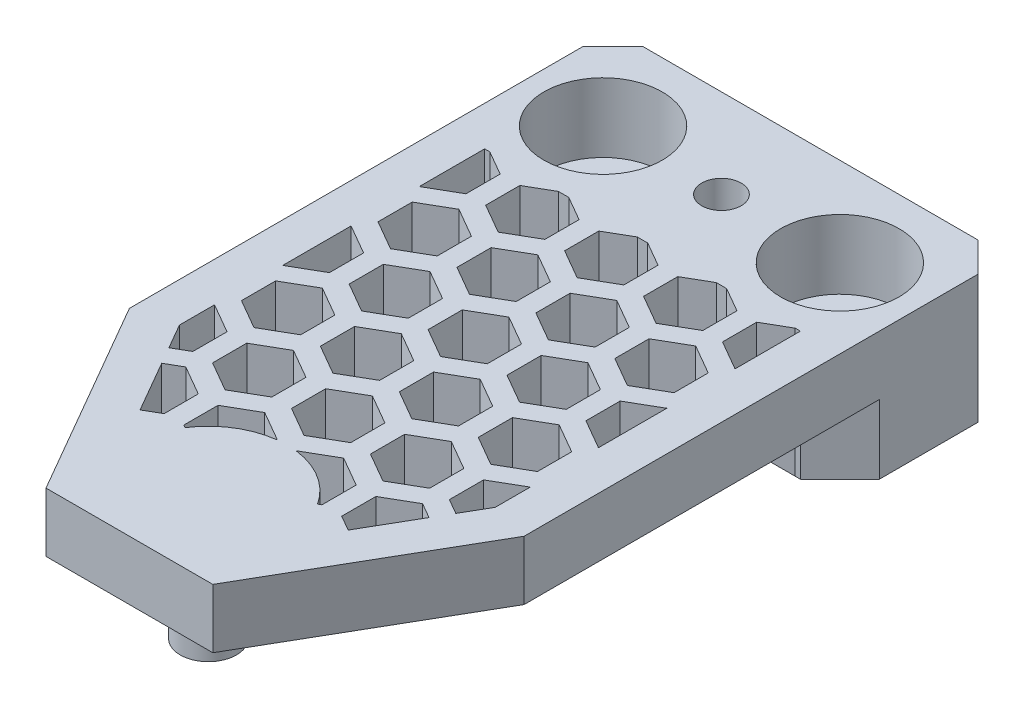
from build123d import *
from OCP.BRepFilletAPI import BRepFilletAPI_MakeChamfer
from build123d.topology import SkipClean

# Parameters (mm, degrees)
SKETCH2_W                = 20
SKETCH2_H                = 38
SKETCH2_R                = 1.5
SKETCH2_R_2              = 0.5
SKETCH2_R_3              = 1
BOSS_EXTRUDE1_DEPTH      = 3
CHAMFER2_SIZE            = 10
CHAMFER2_SIZE2           = 5.773502692
SKETCH3_R                = 1.425
BOSS_EXTRUDE2_DEPTH      = 6.5
BOSS_EXTRUDE3_START      = 3.5
SKETCH5_W                = 20
SKETCH5_H                = 12
SKETCH5_R                = 1.5
BOSS_EXTRUDE3_DEPTH      = 3.5
CHAMFER3_SIZE            = 5
CHAMFER4_SIZE            = 3.5
BOSS_EXTRUDE6_DEPTH      = 20
SKETCH13_W               = 2
SKETCH13_H               = 3.5
CUT_EXTRUDE14_DEPTH      = 3.5
CUT_EXTRUDE12_DEPTH      = 3.5
CUT_EXTRUDE12_DEPTH_BACK = 3.5
SKETCH7_R                = 3
CUT_EXTRUDE13_DEPTH      = 3.5
SKETCH9_R                = 2.625
BOSS_EXTRUDE4_DEPTH      = 0.5
BOSS_EXTRUDE5_START      = 0.55
SKETCH10_R               = 2.4
SKETCH10_R_2             = 1.5
BOSS_EXTRUDE5_DEPTH      = 0.55


with BuildPart() as part:
    # Sketch2 → Boss-Extrude1 (new body)
    with BuildSketch(Plane(origin=(0, 0, 0), x_dir=(1, 0, 0), z_dir=(0, 1, 0))):
        with Locations((0, 15)):
            Rectangle(SKETCH2_W, SKETCH2_H)
        with Locations(Location((-6, 26, 0), (0, 0, 270))):
            Circle(SKETCH2_R, mode=Mode.SUBTRACT)
        with Locations(Location((6, 26, 0), (0, 0, 270))):
            Circle(SKETCH2_R, mode=Mode.SUBTRACT)
        with Locations(Location((0, 0, 0), (0, 0, 270))):
            Circle(SKETCH2_R_2, mode=Mode.SUBTRACT)
        with Locations(Location((0, 26, 0), (0, 0, 270))):
            Circle(SKETCH2_R_3, mode=Mode.SUBTRACT)
    extrude(amount=BOSS_EXTRUDE1_DEPTH)

    # Chamfer2: one chamfer whose edges measure the first distance from different faces: ONE call of the kernel's chamfer builder (chamfer() names one face for all edges)
    chamfer2_edges_1 = [part.edges().sort_by_distance(p)[0] for p in [
        (10, 1.5, 4),
    ]]
    chamfer2_side_1 = [part.faces().sort_by_distance(p)[0] for p in [
        (10, 1.5, -15),
    ]]
    chamfer2_edges_2 = [part.edges().sort_by_distance(p)[0] for p in [
        (-10, 1.5, 4),
    ]]
    chamfer2_side_2 = [part.faces().sort_by_distance(p)[0] for p in [
        (-10, 1.5, -15),
    ]]
    chamfer2 = BRepFilletAPI_MakeChamfer(part.part.solid().wrapped)
    for e in chamfer2_edges_1:
        chamfer2.Add(CHAMFER2_SIZE, CHAMFER2_SIZE2, e.wrapped, chamfer2_side_1[0].wrapped)  # the first distance lies on this face
    for e in chamfer2_edges_2:
        chamfer2.Add(CHAMFER2_SIZE, CHAMFER2_SIZE2, e.wrapped, chamfer2_side_2[0].wrapped)  # the first distance lies on this face
    add(Compound.cast(chamfer2.Shape()), mode=Mode.REPLACE)

    # Sketch3 → Boss-Extrude2 (add)
    with BuildSketch(Plane(origin=(0, 3, 0), x_dir=(1, 0, 0), z_dir=(0, 1, 0))):
        with Locations(Location((0, 0, 0), (0, 0, 270))):
            Circle(SKETCH3_R)
    extrude(amount=-BOSS_EXTRUDE2_DEPTH)

    # Sketch5 → Boss-Extrude3 (add)
    with SkipClean():  # the faces are left unmerged after this step: merging them gives an invalid solid
        with BuildSketch(Plane.XZ.offset(BOSS_EXTRUDE3_START)):
            with Locations((0, -28)):
                Rectangle(SKETCH5_W, SKETCH5_H)
            with Locations(Location((-6, -26, 0), (0, 0, 270))):
                Circle(SKETCH5_R, mode=Mode.SUBTRACT)
            with Locations(Location((6, -26, 0), (0, 0, 270))):
                Circle(SKETCH5_R, mode=Mode.SUBTRACT)
        extrude(amount=-BOSS_EXTRUDE3_DEPTH)

    # Chamfer3
    chamfer3_edges = [part.edges().sort_by_distance(p)[0] for p in [
        (-10, -1.75, -34),
        (10, -1.75, -34),
    ]]
    chamfer(chamfer3_edges, length=CHAMFER3_SIZE)

    # Chamfer4
    # the kernel refuses this chamfer: 3.5 mm, written as the material it takes off along each edge
    with BuildSketch(Plane(origin=(-14.000890458, 3, -34), x_dir=(0, 0.027495876610586372, 0.9996219169112968), z_dir=(1, 0, 0))) as chamfer4_piece_1:
        Polygon((CHAMFER4_SIZE * 0.999621916911, CHAMFER4_SIZE * 0.0274958766106), (-CHAMFER4_SIZE * 0.0274958766106, CHAMFER4_SIZE * 0.999621916911), (0, 0), align=None)
    extrude(amount=28.001780916, mode=Mode.SUBTRACT)

    # Sketch12 → Boss-Extrude6 (add)
    with BuildSketch(Plane(origin=(10, 0, 0), x_dir=(0, 0, -1), z_dir=(1, 0, 0))):
        Polygon((22, 0), (18.5, 0), (22, -3.5), align=None)
    extrude(amount=-BOSS_EXTRUDE6_DEPTH)

    # Sketch13 → Cut-Extrude14 (cut)
    with BuildSketch(Plane.XZ.offset(3.5)):
        with Locations((-9, -20.25)):
            Rectangle(SKETCH13_W, SKETCH13_H)
        Polygon((-10, -22), (-10, -24), (-8, -22), align=None)
        with Locations((9, -20.25)):
            Rectangle(SKETCH13_W, SKETCH13_H)
        Polygon((10, -22), (8, -22), (10, -24), align=None)
    extrude(amount=-CUT_EXTRUDE14_DEPTH, mode=Mode.SUBTRACT)

    # Sketch6 → Cut-Extrude12 (cut, two sides: drawn at the far end of the back side and taken through both)
    with BuildSketch(Plane.XZ.offset(-CUT_EXTRUDE12_DEPTH_BACK)):
        Polygon((-8, -18.687949192), (-8, -22), (-7.736640276, -22), (-6.5, -21.286025404), (-6.5, -19.553974596), align=None)
        Polygon((-0.263359724, -22), (0.263359724, -22), (1.5, -21.286025404), (1.5, -19.553974596), (0, -18.687949192), (-1.5, -19.553974596), (-1.5, -21.286025404), align=None)
        Polygon((-5.5, -21.286025404), (-4.263359724, -22), (-3.736640276, -22), (-2.5, -21.286025404), (-2.5, -19.553974596), (-4, -18.687949192), (-5.5, -19.553974596), align=None)
        Polygon((6.5, -21.286025404), (7.736640276, -22), (8, -22), (8, -18.687949192), (6.5, -19.553974596), align=None)
        Polygon((2.5, -21.286025404), (3.736640276, -22), (4.263359724, -22), (5.5, -21.286025404), (5.5, -19.553974596), (4, -18.687949192), (2.5, -19.553974596), align=None)
        Polygon((-8, -11.767949192), (-8, -15.232050808), (-6.5, -14.366025404), (-6.5, -12.633974596), align=None)
        Polygon((-1.5, -14.366025404), (0, -15.232050808), (1.5, -14.366025404), (1.5, -12.633974596), (0, -11.767949192), (-1.5, -12.633974596), align=None)
        Polygon((6.5, -14.366025404), (8, -15.232050808), (8, -11.767949192), (6.5, -12.633974596), align=None)
        Polygon((-8, -6.535898385), (-8, -8.312050808), (-6.5, -7.446025404), (-6.5, -5.713974596), (-7.26909656, -5.269936491), align=None)
        Polygon((-1.5, -7.446025404), (0, -8.312050808), (1.5, -7.446025404), (1.5, -5.713974596), (0, -4.847949192), (-1.5, -5.713974596), align=None)
        Polygon((6.5, -7.446025404), (8, -8.312050808), (8, -6.535898385), (7.26909656, -5.269936491), (6.5, -5.713974596), align=None)
        Polygon((-5.272648662, -1.811987298), (-6.772648662, -4.410063509), (-6, -4.856152423), (-4.5, -3.990127019), (-4.5, -2.258076211), align=None)
        with BuildLine():
            Line((-0.5, -3.990127019), (-0.5, -3.968626967))
            ThreePointArc((-0.5, -3.968626967), (-2.126633668, -3.387835481), (-3.356749066, -2.175370246))
            Line((-3.356749066, -2.175370246), (-3.5, -2.258076211))
            Line((-3.5, -2.258076211), (-3.5, -3.990127019))
            Line((-3.5, -3.990127019), (-2, -4.856152423))
            Line((-2, -4.856152423), (-0.5, -3.990127019))
        make_face()
        with BuildLine():
            ThreePointArc((3.356749066, -2.175370246), (2.126633668, -3.387835481), (0.5, -3.968626967))
            Line((0.5, -3.968626967), (0.5, -3.990127019))
            Line((0.5, -3.990127019), (2, -4.856152423))
            Line((2, -4.856152423), (3.5, -3.990127019))
            Line((3.5, -3.990127019), (3.5, -2.258076211))
            Line((3.5, -2.258076211), (3.356749066, -2.175370246))
        make_face()
        Polygon((6, -4.856152423), (6.772648662, -4.410063509), (5.272648662, -1.811987298), (4.5, -2.258076211), (4.5, -3.990127019), align=None)
        Polygon((5.5, -12.633974596), (4, -11.767949192), (2.5, -12.633974596), (2.5, -14.366025404), (4, -15.232050808), (5.5, -14.366025404), align=None)
        Polygon((-2.5, -12.633974596), (-4, -11.767949192), (-5.5, -12.633974596), (-5.5, -14.366025404), (-4, -15.232050808), (-2.5, -14.366025404), align=None)
        Polygon((3.5, -16.098076211), (2, -15.232050808), (0.5, -16.098076211), (0.5, -17.830127019), (2, -18.696152423), (3.5, -17.830127019), align=None)
        Polygon((-3.5, -17.830127019), (-2, -18.696152423), (-0.5, -17.830127019), (-0.5, -16.098076211), (-2, -15.232050808), (-3.5, -16.098076211), align=None)
        Polygon((7.5, -16.098076211), (6, -15.232050808), (4.5, -16.098076211), (4.5, -17.830127019), (6, -18.696152423), (7.5, -17.830127019), align=None)
        Polygon((3.5, -9.178076211), (2, -8.312050808), (0.5, -9.178076211), (0.5, -10.910127019), (2, -11.776152423), (3.5, -10.910127019), align=None)
        Polygon((7.5, -9.178076211), (6, -8.312050808), (4.5, -9.178076211), (4.5, -10.910127019), (6, -11.776152423), (7.5, -10.910127019), align=None)
        Polygon((-0.5, -9.178076211), (-2, -8.312050808), (-3.5, -9.178076211), (-3.5, -10.910127019), (-2, -11.776152423), (-0.5, -10.910127019), align=None)
        Polygon((-4.5, -16.098076211), (-6, -15.232050808), (-7.5, -16.098076211), (-7.5, -17.830127019), (-6, -18.696152423), (-4.5, -17.830127019), align=None)
        Polygon((-4.5, -9.178076211), (-6, -8.312050808), (-7.5, -9.178076211), (-7.5, -10.910127019), (-6, -11.776152423), (-4.5, -10.910127019), align=None)
        Polygon((5.5, -5.713974596), (4, -4.847949192), (2.5, -5.713974596), (2.5, -7.446025404), (4, -8.312050808), (5.5, -7.446025404), align=None)
        Polygon((-2.5, -5.713974596), (-4, -4.847949192), (-5.5, -5.713974596), (-5.5, -7.446025404), (-4, -8.312050808), (-2.5, -7.446025404), align=None)
    extrude(amount=CUT_EXTRUDE12_DEPTH + CUT_EXTRUDE12_DEPTH_BACK, mode=Mode.SUBTRACT)

    # Sketch7 → Cut-Extrude13 (cut)
    with BuildSketch(Plane(origin=(0, 3, 0), x_dir=(1, 0, 0), z_dir=(0, 1, 0))):
        with Locations(Location((-6, 26, 0), (0, 0, 270))):
            Circle(SKETCH7_R)
        with Locations(Location((6, 26, 0), (0, 0, 270))):
            Circle(SKETCH7_R)
    extrude(amount=-CUT_EXTRUDE13_DEPTH, mode=Mode.SUBTRACT)

    # Sketch9 → Boss-Extrude4 (add)
    with BuildSketch(Plane.XZ):
        with Locations(Location((0, 0, 0), (0, 0, 90))):
            Circle(SKETCH9_R)
    extrude(amount=BOSS_EXTRUDE4_DEPTH)

    # Sketch10 → Boss-Extrude5 (add)
    # profile 1 of 2: a face of its own
    with BuildSketch(Plane.XZ.offset(3.5).offset(BOSS_EXTRUDE5_START)):
        with Locations(Location((-6, -26, 0), (0, 0, 90))):
            Circle(SKETCH10_R)
        with Locations(Location((-6, -26, 0), (0, 0, 270))):
            Circle(SKETCH10_R_2, mode=Mode.SUBTRACT)
    # profile 2 of 2: a face of its own
    with BuildSketch(Plane.XZ.offset(3.5).offset(BOSS_EXTRUDE5_START)):
        with Locations(Location((6, -26, 0), (0, 0, 90))):
            Circle(SKETCH10_R)
        with Locations(Location((6, -26, 0), (0, 0, 270))):
            Circle(SKETCH10_R_2, mode=Mode.SUBTRACT)
    extrude(amount=-BOSS_EXTRUDE5_DEPTH)


solid = part.part
